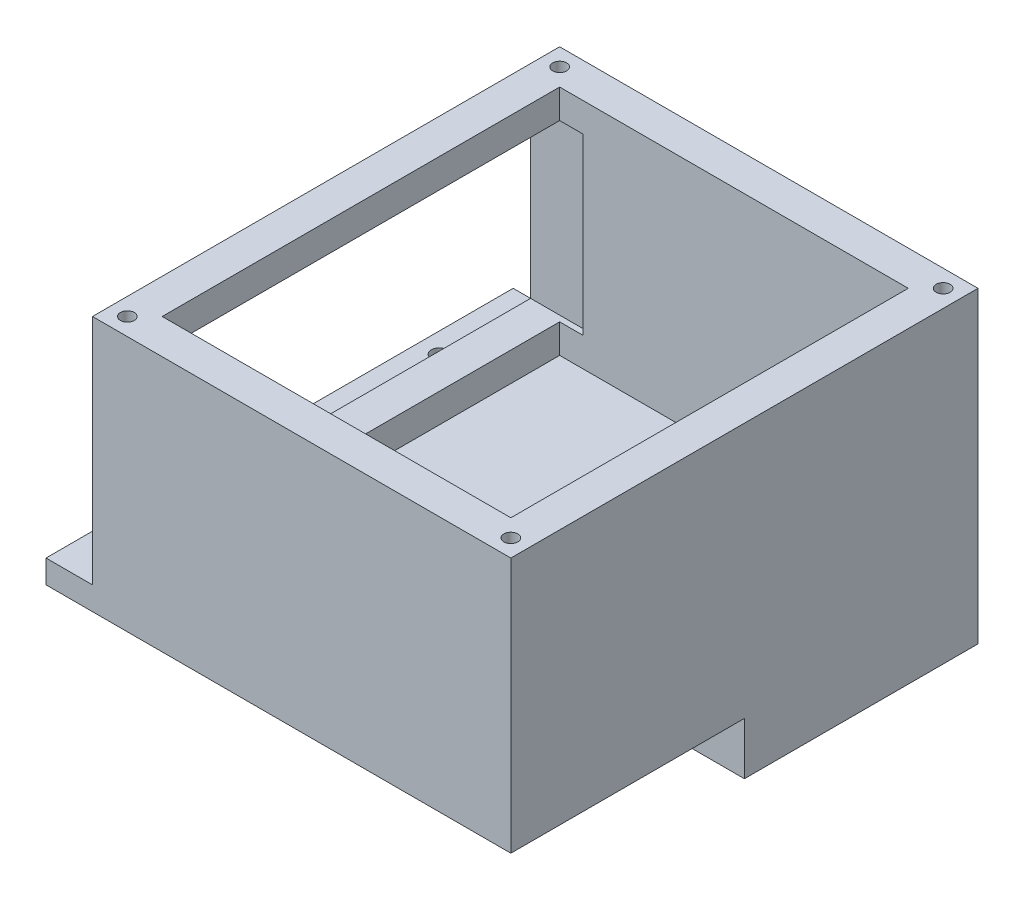
from build123d import *

# Parameters (mm, degrees)
SKETCH1_W           = 80
SKETCH1_H           = 80.4
BOSS_EXTRUDE1_DEPTH = 4
SKETCH3_W           = 70
SKETCH3_H           = 40.2
BOSS_EXTRUDE3_DEPTH = 9
SKETCH4_R           = 1.375
CUT_EXTRUDE1_DEPTH  = 19
CUT_EXTRUDE4_REACH  = 60.181
SKETCH6_W           = 62
SKETCH6_H           = 35.2
SKETCH7_W           = 72
SKETCH7_H           = 80.4
SKETCH7_W_2         = 60
SKETCH7_H_2         = 68.4
BOSS_EXTRUDE4_DEPTH = 40
SKETCH9_R           = 1.2
CUT_EXTRUDE5_DEPTH  = 10
SKETCH10_W          = 70.4
SKETCH10_H          = 30
CUT_EXTRUDE6_DEPTH  = 10
CUT_EXTRUDE7_DEPTH  = 17
FILLET1_R           = 2.4


with BuildPart() as part:
    # Sketch1 → Boss-Extrude1 (new body)
    with BuildSketch(Plane(origin=(0, 0, 0), x_dir=(1, 0, 0), z_dir=(0, 1, 0))):
        Rectangle(SKETCH1_W, SKETCH1_H)
    extrude(amount=BOSS_EXTRUDE1_DEPTH)

    # Sketch3 → Boss-Extrude3 (add)
    with BuildSketch(Plane.XZ):
        with Locations((5, -20.1)):
            Rectangle(SKETCH3_W, SKETCH3_H)
    extrude(amount=BOSS_EXTRUDE3_DEPTH)

    # Sketch4 → Cut-Extrude1 (cut)
    with BuildSketch(Plane.XZ.offset(9)):
        with Locations(Location((-36.5, 24, 0), (0, 0, 270))):
            Circle(SKETCH4_R)
        with Locations(Location((-36.5, -24, 0), (0, 0, 270))):
            Circle(SKETCH4_R)
    extrude(amount=-CUT_EXTRUDE1_DEPTH, mode=Mode.SUBTRACT)

    # Sketch6 → Cut-Extrude4 (cut, up to next)
    with BuildSketch(Plane(origin=(0, 4, 0), x_dir=(1, 0, 0), z_dir=(0, 1, 0)), mode=Mode.PRIVATE) as cut_extrude4_sk1:
        with Locations((4, -17.6)):
            Rectangle(SKETCH6_W, SKETCH6_H)
    cut_extrude4_tool1 = extrude(cut_extrude4_sk1.sketch, amount=-CUT_EXTRUDE4_REACH, mode=Mode.PRIVATE) & part.part
    add(cut_extrude4_tool1.solids().sort_by_distance((4, 4, 17.6))[0], mode=Mode.SUBTRACT)

    # Sketch7 → Boss-Extrude4 (add)
    with BuildSketch(Plane.XZ.offset(-4)):
        with Locations((4, 0)):
            Rectangle(SKETCH7_W, SKETCH7_H)
        with Locations((4, 0)):
            Rectangle(SKETCH7_W_2, SKETCH7_H_2, mode=Mode.SUBTRACT)
    extrude(amount=-BOSS_EXTRUDE4_DEPTH)

    # Sketch9 → Cut-Extrude5 (cut)
    with BuildSketch(Plane(origin=(0, 44, 0), x_dir=(1, 0, 0), z_dir=(0, 1, 0))):
        with Locations(Location((-29, 37.2, 0), (0, 0, 270))):
            Circle(SKETCH9_R)
        with Locations(Location((37, 37.2, 0), (0, 0, 270))):
            Circle(SKETCH9_R)
        with Locations(Location((37, -37.2, 0), (0, 0, 270))):
            Circle(SKETCH9_R)
        with Locations(Location((-29, -37.2, 0), (0, 0, 270))):
            Circle(SKETCH9_R)
    extrude(amount=-CUT_EXTRUDE5_DEPTH, mode=Mode.SUBTRACT)

    # Sketch10 → Cut-Extrude6 (cut)
    with BuildSketch(Plane.ZY.offset(32)):
        with Locations((0, 24)):
            Rectangle(SKETCH10_W, SKETCH10_H)
    extrude(amount=-CUT_EXTRUDE6_DEPTH, mode=Mode.SUBTRACT)

    # Sketch11 → Cut-Extrude7 (cut)
    with BuildSketch(Plane(origin=(0, 9, 0), x_dir=(1, 0, 0), z_dir=(0, 1, 0))):
        Polygon((-32, 0), (-32, -35.2), (-23.981492028, -35.2), (-23.981492028, -34.2), (-26, -34.2), (-26, 0), align=None)
    extrude(amount=-CUT_EXTRUDE7_DEPTH, mode=Mode.SUBTRACT)

    # Fillet1
    # the kernel refuses this fillet: 2.4 mm, written as the material it adds along each edge
    with BuildSketch(Plane(origin=(-32, 4, 0), x_dir=(0, 1, 0), z_dir=(0, 0, -1)), Plane(origin=(-30, 0, 0), x_dir=(-1, 0, 0), z_dir=(0, 0, -1))) as fillet1_piece_1:
        with BuildLine():
            CenterArc((FILLET1_R, -FILLET1_R), FILLET1_R, 90, 90)
            Line((0, -FILLET1_R), (0, 0))
            Line((0, 0), (FILLET1_R, 0))
        make_face()
    extrude(amount=40.2)


solid = part.part
